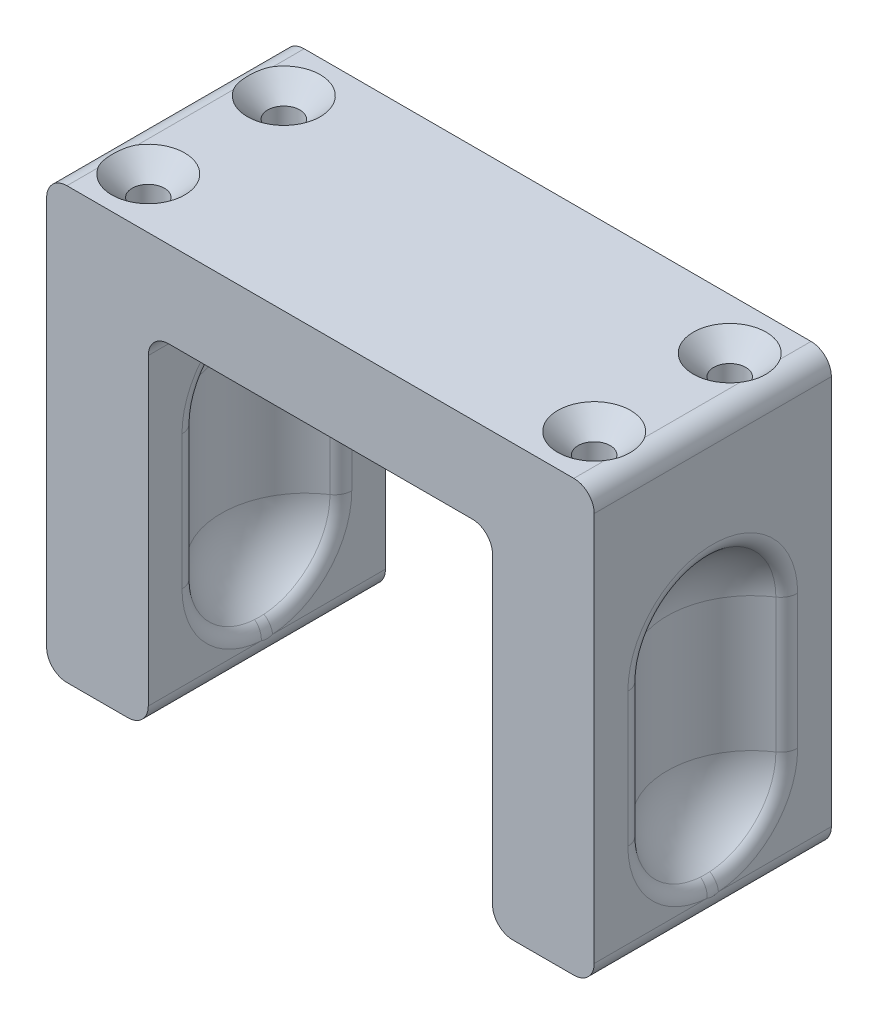
from build123d import *

# Parameters (mm, degrees)
BOSS_EXTRUDE1_DEPTH = 17.5
SKETCH4_R           = 2.375
CUT_EXTRUDE1_DEPTH  = 78.270045943
CHAMFER1_SIZE       = 3
FILLET1_R           = 3
FILLET2_R           = 2.5


with BuildPart() as part:
    # Sketch2 → Boss-Extrude1 (new, symmetric)
    with BuildSketch(Plane.XY):
        Polygon((0, 25.4), (25.4, 25.4), (25.4, -25.4), (40.4, -25.4), (40.4, 38.1), (0, 38.1), align=None)
    extrude(amount=BOSS_EXTRUDE1_DEPTH, both=True)

    # Sketch4 → Cut-Extrude1 (cut, through all)
    with BuildSketch(Plane(origin=(0, 38.1, 0), x_dir=(1, 0, 0), z_dir=(0, 1, 0))):
        with Locations(Location((32.9, 10, 0), (0, 0, 180))):
            Circle(SKETCH4_R)
        with Locations(Location((32.9, -10, 0), (0, 0, 180))):
            Circle(SKETCH4_R)
    extrude(amount=-CUT_EXTRUDE1_DEPTH, mode=Mode.SUBTRACT)

    # Chamfer1
    chamfer1_edges = [part.edges().sort_by_distance(p)[0] for p in [
        (35.275, 38.1, -10),
        (35.275, 38.1, 10),
    ]]
    chamfer(chamfer1_edges, length=CHAMFER1_SIZE)

    # Fillet1
    # the kernel refuses this fillet: 3 mm, written as the material it adds along each edge
    with BuildSketch(Plane(origin=(25.4, 25.4, -17.5), x_dir=(-1, 0, 0), z_dir=(0, 0, 1))) as fillet1_piece_1:
        with BuildLine():
            CenterArc((FILLET1_R, FILLET1_R), FILLET1_R, 180, 90)
            Line((0, FILLET1_R), (0, 0))
            Line((0, 0), (FILLET1_R, 0))
        make_face()
    extrude(amount=35)
    # the kernel refuses this fillet: 3 mm, written as the material it takes off along each edge
    with BuildSketch(Plane(origin=(40.4, 38.1, 25), x_dir=(-1, 0, 0), z_dir=(0, 0, -1)), Plane(origin=(25.4, -25.4, -25), x_dir=(0, 1, 0), z_dir=(0, 0, 1))) as fillet1_2_piece_1:
        with BuildLine():
            CenterArc((FILLET1_R, -FILLET1_R), FILLET1_R, 90, 90)
            Line((0, -FILLET1_R), (0, 0))
            Line((0, 0), (FILLET1_R, 0))
        make_face()
    extrude(amount=50, mode=Mode.SUBTRACT)
    with BuildSketch(Plane(origin=(40.4, -25.4, -25), x_dir=(0, 1, 0), z_dir=(0, 0, 1))) as fillet1_2_piece_2:
        with BuildLine():
            CenterArc((FILLET1_R, FILLET1_R), FILLET1_R, 180, 90)
            Line((0, FILLET1_R), (0, 0))
            Line((0, 0), (FILLET1_R, 0))
        make_face()
    extrude(amount=50, mode=Mode.SUBTRACT)

    # Sketch5 → Cut-Revolve3 (revolve, cut)
    with BuildSketch(Plane.XY):
        with BuildLine():
            Line((19.65, 22.4), (19.65, -22.4))
            ThreePointArc((19.65, -22.4), (28.488834765, -18.738834765), (32.15, -9.9))
            Line((32.15, -9.9), (32.15, 9.9))
            ThreePointArc((32.15, 9.9), (28.488834765, 18.738834765), (19.65, 22.4))
        make_face()
    cut_revolve3 = revolve(axis=Axis((19.65, 22.4, 0), (0, -1, 0)), mode=Mode.SUBTRACT)

    # Mirror2: Cut-Revolve3 across plane
    add(cut_revolve3.mirror(Plane.ZY.offset(-32.9)), mode=Mode.SUBTRACT)

    # Fillet2
    fillet2_edges = [part.edges().sort_by_distance(p)[0] for p in [
        (25.4, -20.99898644, 0),
        (25.4, 0, 11.09898644),
        (25.4, 0, -11.09898644),
        (25.4, 20.99898644, 0),
        (40.4, -20.99898644, 0),
        (40.4, 0, -11.09898644),
        (40.4, 0, 11.09898644),
        (40.4, 20.99898644, 0),
    ]]
    fillet(fillet2_edges, radius=FILLET2_R)

    # Mirror1: part across plane


with BuildPart() as part_1:
    add(part.part)
    add(part.part.mirror(Plane(origin=(0, 38.1, 17.5), x_dir=(0, 0, 1), z_dir=(1, 0, 0))))


solid = part_1.part
